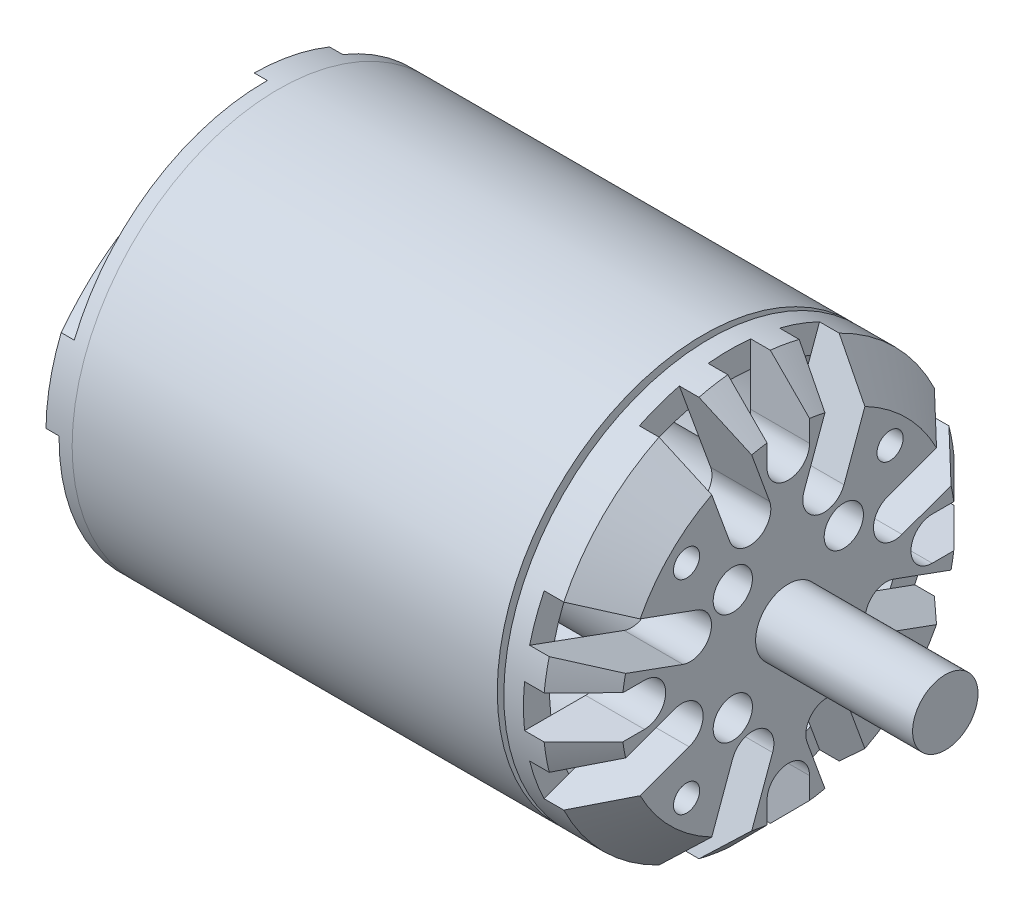
from build123d import *

# Parameters (mm, degrees)
SKETCH1_R      = 31.5
EXTRUDE1_DEPTH = 92
SKETCH2_R      = 5
EXTRUDE2_DEPTH = 24
EXTRUDE3_START = -9
EXTRUDE3_DEPTH = 9
CHAMFER1_SIZE  = 6
SKETCH4_R      = 31.5
SKETCH4_R_2    = 14.5
EXTRUDE4_DEPTH = 3
EXTRUDE5_START = -9
EXTRUDE5_DEPTH = 9
CHAMFER2_SIZE  = 7
CHAMFER2_SIZE2 = 14.352126891
SKETCH7_R      = 27.5
SKETCH7_R_2    = 12.5
EXTRUDE6_DEPTH = 71
SKETCH8_W      = 1
SKETCH8_H      = 4
SKETCH10_R     = 31.5
SKETCH10_R_2   = 31.494
EXTRUDE7_DEPTH = 14
SKETCH11_R     = 2
SKETCH11_R_2   = 3
EXTRUDE8_DEPTH = 9


# Read off the part's stored shape, not the designer's step: Extrude5
with BuildPart() as part:
    # Sketch1 → Extrude1 (new body)
    with BuildSketch(Plane(origin=(0, 0, 0), x_dir=(0, 0, -1), z_dir=(1, 0, 0))):
        Circle(SKETCH1_R)
    extrude(amount=EXTRUDE1_DEPTH)

    # Sketch2 → Extrude2 (add)
    with BuildSketch(Plane(origin=(92, 0, 0), x_dir=(0, 0, -1), z_dir=(1, 0, 0))):
        Circle(SKETCH2_R)
    extrude(amount=EXTRUDE2_DEPTH)

    # Sketch3 → Extrude3 (cut)
    with BuildSketch(Plane(origin=(92, 0, 0), x_dir=(0, 0, -1), z_dir=(1, 0, 0)).offset(EXTRUDE3_START)):
        with BuildLine():
            ThreePointArc((-22, -3.25), (-19.701902961, -2.298097039), (-18.75, 0))
            ThreePointArc((-18.75, 0), (-19.701902961, 2.298097039), (-22, 3.25))
            Line((-22, 3.25), (-31.331892697, 3.25))
            ThreePointArc((-31.331892697, 3.25), (-31.5, 0), (-31.331892697, -3.25))
            Line((-31.331892697, -3.25), (-22, -3.25))
        make_face()
        with BuildLine():
            ThreePointArc((-16.111565466, 2.405552496), (-13.626490649, 2.514053206), (-11.945998982, 4.347988048))
            ThreePointArc((-11.945998982, 4.347988048), (-12.054499692, 6.833062865), (-13.888434534, 8.513554532))
            Line((-13.888434534, 8.513554532), (-28.330782897, 13.770139449))
            ThreePointArc((-28.330782897, 13.770139449), (-29.600317555, 10.773634515), (-30.553913829, 7.662137413))
            Line((-30.553913829, 7.662137413), (-16.111565466, 2.405552496))
        make_face()
        with BuildLine():
            ThreePointArc((-15.164388161, -8.977963672), (-13.330453319, -7.297472005), (-13.221952609, -4.812397189))
            ThreePointArc((-13.221952609, -4.812397189), (-14.902444276, -2.978462347), (-17.387519093, -2.869961637))
            Line((-17.387519093, -2.869961637), (-30.553913829, -7.662137413))
            ThreePointArc((-30.553913829, -7.662137413), (-29.600317555, -10.773634515), (-28.330782897, -13.770139449))
            Line((-28.330782897, -13.770139449), (-15.164388161, -8.977963672))
        make_face()
        with BuildLine():
            Line((-8.513554532, -13.888434534), (-13.770139449, -28.330782897))
            ThreePointArc((-13.770139449, -28.330782897), (-10.773634515, -29.600317555), (-7.662137413, -30.553913829))
            Line((-7.662137413, -30.553913829), (-2.405552496, -16.111565466))
            ThreePointArc((-2.405552496, -16.111565466), (-4.347988048, -11.945998982), (-8.513554532, -13.888434534))
        make_face()
        with BuildLine():
            Line((-3.25, -22), (-3.25, -31.331892697))
            ThreePointArc((-3.25, -31.331892697), (0, -31.5), (3.25, -31.331892697))
            Line((3.25, -31.331892697), (3.25, -22))
            ThreePointArc((3.25, -22), (0, -18.75), (-3.25, -22))
        make_face()
        with BuildLine():
            Line((2.869961637, -17.387519093), (7.662137413, -30.553913829))
            ThreePointArc((7.662137413, -30.553913829), (10.773634515, -29.600317555), (13.770139449, -28.330782897))
            Line((13.770139449, -28.330782897), (8.977963672, -15.164388161))
            ThreePointArc((8.977963672, -15.164388161), (4.812397189, -13.221952609), (2.869961637, -17.387519093))
        make_face()
        with BuildLine():
            Line((13.888434534, -8.513554532), (28.330782897, -13.770139449))
            ThreePointArc((28.330782897, -13.770139449), (29.600317555, -10.773634515), (30.553913829, -7.662137413))
            Line((30.553913829, -7.662137413), (16.111565466, -2.405552496))
            ThreePointArc((16.111565466, -2.405552496), (11.945998982, -4.347988048), (13.888434534, -8.513554532))
        make_face()
        with BuildLine():
            ThreePointArc((31.5, 0), (31.457945101, 1.627172399), (31.331892697, 3.25))
            Line((31.331892697, 3.25), (22, 3.25))
            ThreePointArc((22, 3.25), (18.75, 0), (22, -3.25))
            Line((22, -3.25), (31.331892697, -3.25))
            ThreePointArc((31.331892697, -3.25), (31.457945101, -1.627172399), (31.5, 0))
        make_face()
        with BuildLine():
            ThreePointArc((30.553913829, 7.662137413), (29.600317555, 10.773634515), (28.330782897, 13.770139449))
            Line((28.330782897, 13.770139449), (15.164388161, 8.977963672))
            ThreePointArc((15.164388161, 8.977963672), (13.221952609, 4.812397189), (17.387519093, 2.869961637))
            Line((17.387519093, 2.869961637), (30.553913829, 7.662137413))
        make_face()
        with BuildLine():
            ThreePointArc((13.770139449, 28.330782897), (10.773634515, 29.600317555), (7.662137413, 30.553913829))
            Line((7.662137413, 30.553913829), (2.405552496, 16.111565466))
            ThreePointArc((2.405552496, 16.111565466), (4.347988048, 11.945998982), (8.513554532, 13.888434534))
            Line((8.513554532, 13.888434534), (13.770139449, 28.330782897))
        make_face()
        with BuildLine():
            ThreePointArc((3.25, 31.331892697), (0, 31.5), (-3.25, 31.331892697))
            Line((-3.25, 31.331892697), (-3.25, 22))
            ThreePointArc((-3.25, 22), (0, 18.75), (3.25, 22))
            Line((3.25, 22), (3.25, 31.331892697))
        make_face()
        with BuildLine():
            ThreePointArc((-7.662137413, 30.553913829), (-10.773634515, 29.600317555), (-13.770139449, 28.330782897))
            Line((-13.770139449, 28.330782897), (-8.977963672, 15.164388161))
            ThreePointArc((-8.977963672, 15.164388161), (-4.812397189, 13.221952609), (-2.869961637, 17.387519093))
            Line((-2.869961637, 17.387519093), (-7.662137413, 30.553913829))
        make_face()
    extrude(amount=EXTRUDE3_DEPTH, mode=Mode.SUBTRACT)

    # Chamfer1
    chamfer1_edges = [part.edges().sort_by_distance(p)[0] for p in [
        (92, 22.273863607, -22.273863607),
        (92, 31.02144422, -5.469917597),
        (92, 31.02144422, 5.469917597),
        (92, 22.273863607, 22.273863607),
        (92, 5.469917597, 31.02144422),
        (92, -22.273863607, 22.273863607),
        (92, -31.02144422, 5.469917597),
        (92, -31.02144422, -5.469917597),
        (92, -22.273863607, -22.273863607),
        (92, -5.469917597, -31.02144422),
        (92, 5.469917597, -31.02144422),
        (92, -5.469917597, 31.02144422),
    ]]
    chamfer(chamfer1_edges, length=CHAMFER1_SIZE)

    # Sketch4 → Extrude4 (cut)
    with BuildSketch(Plane.ZY):
        Circle(SKETCH4_R)
        Circle(SKETCH4_R_2, mode=Mode.SUBTRACT)
    extrude(amount=-EXTRUDE4_DEPTH, mode=Mode.SUBTRACT)

    # Extrude5 outline → Extrude5 (cut)
    with BuildSketch(Plane.ZY.offset(-3).offset(EXTRUDE5_START)):
        with BuildLine():
            ThreePointArc((-11.866312014, 29.179455773), (-26.13464012, 17.584953392), (-31.5, 0))
            ThreePointArc((-31.5, 0), (-24, -7.5), (-16.5, 0))
            ThreePointArc((-16.5, 0), (-15.999682886, 14.878191758), (-11.866312014, 29.179455773))
        make_face()
        with BuildLine():
            ThreePointArc((0, -16.5), (-14.878191758, -15.999682886), (-29.179455773, -11.866312014))
            ThreePointArc((-29.179455773, -11.866312014), (-17.584953392, -26.13464012), (0, -31.5))
            ThreePointArc((0, -31.5), (7.5, -24), (0, -16.5))
        make_face()
        with BuildLine():
            ThreePointArc((29.179455773, 11.866312014), (17.584953392, 26.13464012), (0, 31.5))
            ThreePointArc((0, 31.5), (-7.5, 24), (0, 16.5))
            ThreePointArc((0, 16.5), (14.878191758, 15.999682886), (29.179455773, 11.866312014))
        make_face()
        with BuildLine():
            ThreePointArc((16.5, 0), (15.999682886, -14.878191758), (11.866312014, -29.179455773))
            ThreePointArc((11.866312014, -29.179455773), (26.13464012, -17.584953392), (31.5, 0))
            ThreePointArc((31.5, 0), (24, 7.5), (16.5, 0))
        make_face()
    extrude(amount=EXTRUDE5_DEPTH, mode=Mode.SUBTRACT)

    # Chamfer2
    chamfer2_edges = [part.edges().sort_by_distance(p)[0] for p in [
        (3, -6.045541463, -30.914421043),
        (3, 30.914421043, -6.045541463),
        (3, 6.045541463, 30.914421043),
        (3, -30.914421043, 6.045541463),
    ]]
    chamfer2_side = [part.faces().sort_by_distance(p)[0] for p in [
        (44.5, 0, 31.5),
    ]]
    chamfer(chamfer2_edges, length=CHAMFER2_SIZE, length2=CHAMFER2_SIZE2, reference=chamfer2_side[0])

    # Sketch7 → Extrude6 (cut)
    with BuildSketch(Plane.ZY.offset(-12)):
        with Locations(Location((0, 0, 0), (0, 0, 353.212818265))):
            Circle(SKETCH7_R)
        Circle(SKETCH7_R_2, mode=Mode.SUBTRACT)
    extrude(amount=-EXTRUDE6_DEPTH, mode=Mode.SUBTRACT)

    # Sketch8 → Cut-Revolve1 (revolve, cut)
    with BuildSketch(Plane.XY, mode=Mode.PRIVATE) as cut_revolve1_sk:
        with Locations((79.5, 29.5)):
            Rectangle(SKETCH8_W, SKETCH8_H)
    revolve(cut_revolve1_sk.sketch.rotate(Axis((116, 0, 0), (-1, 0, 0)), 275.922007806), axis=Axis((116, 0, 0), (-1, 0, 0)), mode=Mode.SUBTRACT)

    # Sketch10 → Extrude7 (cut)
    with BuildSketch(Plane.ZY):
        Circle(SKETCH10_R)
        Circle(SKETCH10_R_2, mode=Mode.SUBTRACT)
    extrude(amount=-EXTRUDE7_DEPTH, mode=Mode.SUBTRACT)

    # Sketch11 → Extrude8 (cut)
    with BuildSketch(Plane(origin=(92, 0, 0), x_dir=(0, 0, -1), z_dir=(1, 0, 0))):
        with Locations((-15.556349186, 15.556349186)):
            Circle(SKETCH11_R)
        with Locations((-8.485281374, 8.485281374)):
            Circle(SKETCH11_R_2)
        with Locations((15.556349186, 15.556349186)):
            Circle(SKETCH11_R)
        with Locations((8.485281374, 8.485281374)):
            Circle(SKETCH11_R_2)
        with Locations((15.556349186, -15.556349186)):
            Circle(SKETCH11_R)
        with Locations((8.485281374, -8.485281374)):
            Circle(SKETCH11_R_2)
        with Locations((-15.556349186, -15.556349186)):
            Circle(SKETCH11_R)
        with Locations((-8.485281374, -8.485281374)):
            Circle(SKETCH11_R_2)
    extrude(amount=-EXTRUDE8_DEPTH, mode=Mode.SUBTRACT)


solid = part.part
